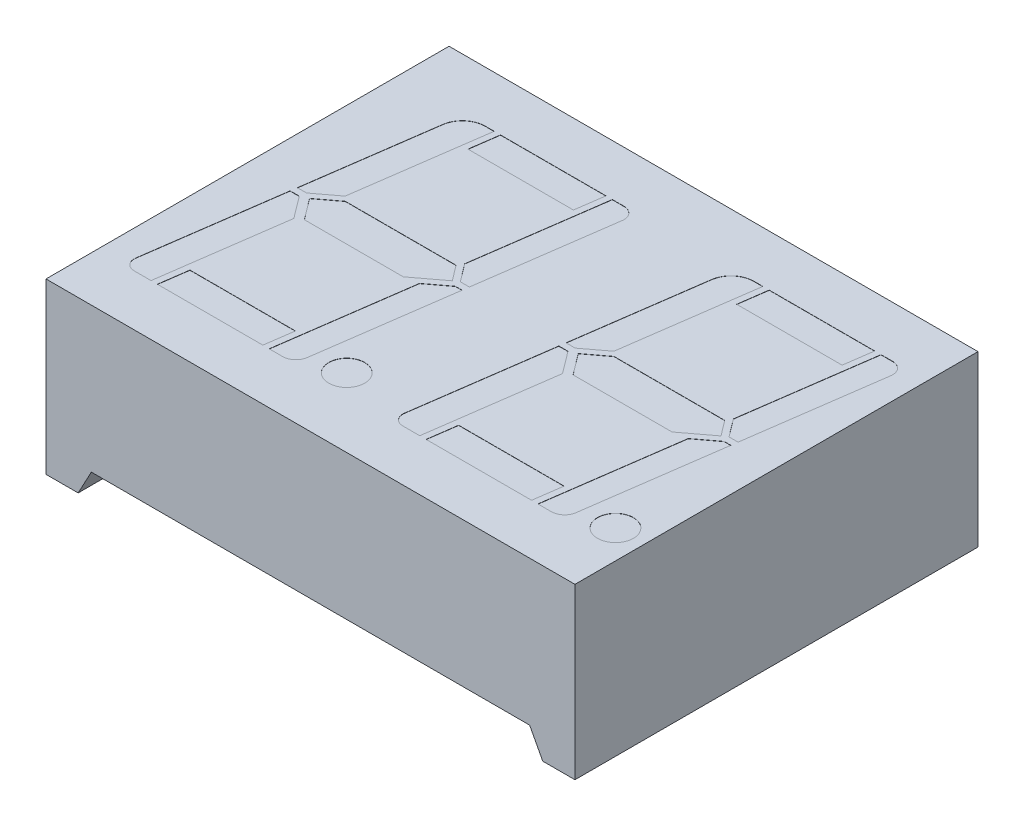
from build123d import *

# Parameters (mm, degrees)
SKETCH1_W           = 25
SKETCH1_H           = 19.05
BOSS_EXTRUDE1_DEPTH = 8
CUT_EXTRUDE1_DEPTH  = 25.148550681
SKETCH3_R           = 0.85
CUT_EXTRUDE3_DEPTH  = 0.01
LPATTERN3_COUNT     = 2
LPATTERN3_PITCH     = 12.7


with BuildPart() as part:
    # Sketch1 → Boss-Extrude1 (new body)
    with BuildSketch(Plane(origin=(0, 0, 0), x_dir=(1, 0, 0), z_dir=(0, 1, 0))):
        Rectangle(SKETCH1_W, SKETCH1_H)
    extrude(amount=BOSS_EXTRUDE1_DEPTH)

    # Sketch2 → Cut-Extrude1 (cut, through all)
    with BuildSketch(Plane.XY.offset(9.525)):
        Polygon((-39.045431316, -52.589778974), (-10.979622637, 0), (-10.357683229, 1.165391541), (10.357683229, 1.165391541), (10.979622637, 0), (39.045431316, -52.589778974), (39.045431316, -171.810154235), (-39.045431316, -171.810154235), align=None)
    extrude(amount=-CUT_EXTRUDE1_DEPTH, mode=Mode.SUBTRACT)

    # Sketch3 → Cut-Extrude3 (cut)
    with BuildSketch(Plane(origin=(0, 8, 0), x_dir=(1, 0, 0), z_dir=(0, 1, 0))):
        with Locations((-1.55, -6.26)):
            Circle(SKETCH3_R)
        with BuildLine():
            Line((-10.293918875, 0.15), (-9.446582946, 6.179108414))
            ThreePointArc((-9.446582946, 6.179108414), (-9.085171861, 6.844744827), (-8.375714675, 7.11))
            Line((-8.375714675, 7.11), (-7.952487442, 7.11))
            Line((-7.952487442, 7.11), (-8.820313991, 0.935093249))
            Line((-8.820313991, 0.935093249), (-9.862167922, 0.15))
            Line((-9.862167922, 0.15), (-10.293918875, 0.15))
        make_face()
        with BuildLine():
            Line((-2.367186588, 7.11), (-1.813478843, 7.11))
            ThreePointArc((-1.813478843, 7.11), (-1.401654728, 6.922320938), (-1.273116986, 6.488384791))
            Line((-1.273116986, 6.488384791), (-2.163918875, 0.15))
            Line((-2.163918875, 0.15), (-2.593918875, 0.15))
            Line((-2.593918875, 0.15), (-3.227234844, 0.990438678))
            Line((-3.227234844, 0.990438678), (-2.367186588, 7.11))
        make_face()
        Polygon((-7.652487442, 7.11), (-2.667186588, 7.11), (-2.856916715, 5.76), (-7.842217569, 5.76), align=None)
        Polygon((-8.604632176, 0.726571417), (-3.369972607, 0.726571417), (-2.822461773, 0), (-4.142522346, -0.994736992), (-8.819236923, -0.994736992), (-9.568825012, 0), align=None)
        with BuildLine():
            Line((-10.336081125, -0.15), (-9.904330172, -0.15))
            Line((-9.904330172, -0.15), (-9.119236923, -1.191853931))
            Line((-9.119236923, -1.191853931), (-9.950978112, -7.11))
            Line((-9.950978112, -7.11), (-10.750461652, -7.11))
            ThreePointArc((-10.750461652, -7.11), (-11.120337027, -6.94143808), (-11.235781811, -6.551703021))
            Line((-11.235781811, -6.551703021), (-10.336081125, -0.15))
        make_face()
        Polygon((-9.650978112, -7.11), (-4.665677257, -7.11), (-4.47594713, -5.76), (-9.461247985, -5.76), align=None)
        with BuildLine():
            Line((-2.206081125, -0.15), (-3.108270084, -6.569408002))
            ThreePointArc((-3.108270084, -6.569408002), (-3.318150529, -6.955959695), (-3.730150039, -7.11))
            Line((-3.730150039, -7.11), (-4.365677257, -7.11))
            Line((-4.365677257, -7.11), (-3.489911075, -0.878599823))
            Line((-3.489911075, -0.878599823), (-2.523026453, -0.15))
            Line((-2.523026453, -0.15), (-2.206081125, -0.15))
        make_face()
    cut_extrude3 = extrude(amount=-CUT_EXTRUDE3_DEPTH, mode=Mode.SUBTRACT)

    # LPattern3: Cut-Extrude3 ×2
    with Locations(*[(i * LPATTERN3_PITCH, 0, 0) for i in range(1, LPATTERN3_COUNT)]):
        add(cut_extrude3, mode=Mode.SUBTRACT)


solid = part.part
